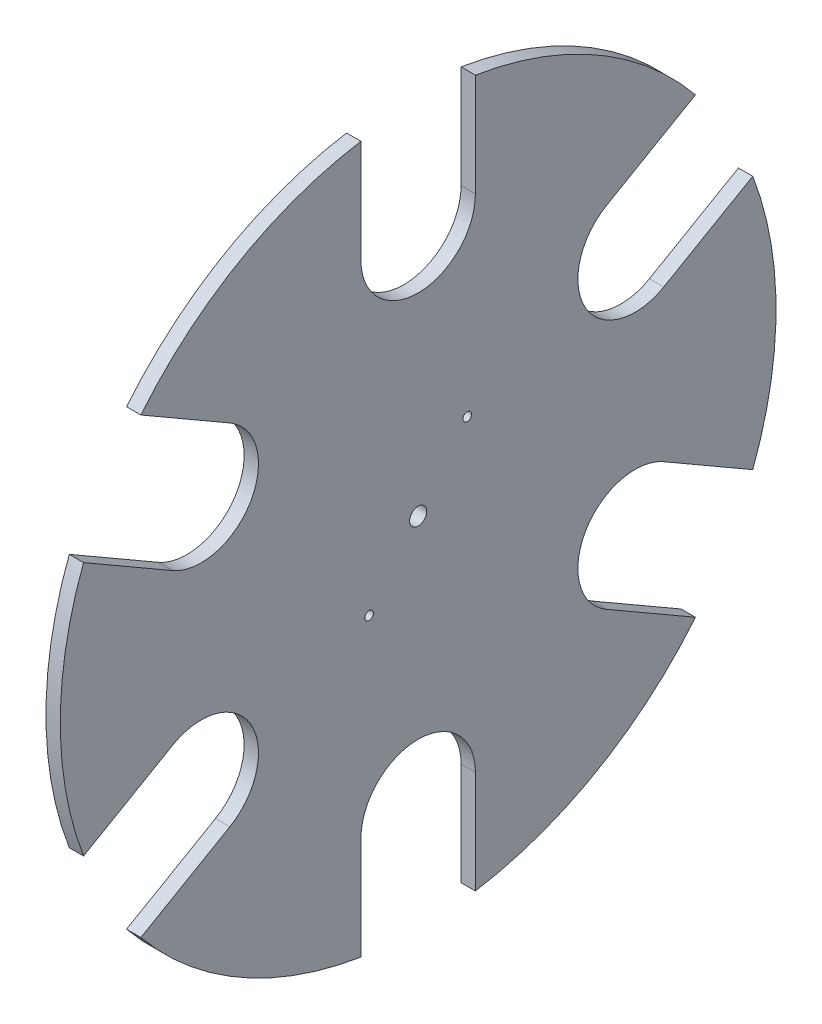
from build123d import *

# Parameters (mm, degrees)
SKETCH1_R               = 250
SKETCH1_R_2             = 6
SKETCH1_R_3             = 40
BOSS_EXTRUDE1_DEPTH     = 10
CUT_EXTRUDE1_DEPTH      = 354.694783677
CUT_EXTRUDE1_DEPTH_BACK = 354.694783677
SKETCH2_R               = 3


with BuildPart() as part:
    # Sketch1 → Boss-Extrude1 (new body)
    with BuildSketch(Plane(origin=(0, 0, 0), x_dir=(0, 0, -1), z_dir=(1, 0, 0))):
        Circle(SKETCH1_R)
        Circle(SKETCH1_R_2, mode=Mode.SUBTRACT)
        with Locations((0, 175)):
            Circle(SKETCH1_R_3, mode=Mode.SUBTRACT)
        with Locations((151.554445662, 87.5)):
            Circle(SKETCH1_R_3, mode=Mode.SUBTRACT)
        with Locations((151.554445662, -87.5)):
            Circle(SKETCH1_R_3, mode=Mode.SUBTRACT)
        with Locations((0, -175)):
            Circle(SKETCH1_R_3, mode=Mode.SUBTRACT)
        with Locations((-151.554445662, -87.5)):
            Circle(SKETCH1_R_3, mode=Mode.SUBTRACT)
        with Locations((-151.554445662, 87.5)):
            Circle(SKETCH1_R_3, mode=Mode.SUBTRACT)
    extrude(amount=BOSS_EXTRUDE1_DEPTH)

    # Sketch2 → Cut-Extrude1 (cut, two sides: drawn at the far end of the back side and taken through both)
    with BuildSketch(Plane.ZY.offset(-CUT_EXTRUDE1_DEPTH_BACK)):
        with Locations((-34.248701956, 43.035176476)):
            Circle(SKETCH2_R)
        with Locations((34.248701956, -43.035176476)):
            Circle(SKETCH2_R)
        with BuildLine():
            Line((-40, 175), (-40, 246.779253585))
            ThreePointArc((-40, 246.779253585), (0, 250), (40, 246.779253585))
            Line((40, 246.779253585), (40, 175))
            ThreePointArc((40, 175), (0, 215), (-40, 175))
        make_face()
        with BuildLine():
            Line((131.554445662, 122.141016151), (193.717102732, 158.030642944))
            ThreePointArc((193.717102732, 158.030642944), (216.506350946, 125), (233.717102732, 88.748610641))
            Line((233.717102732, 88.748610641), (171.554445662, 52.858983849))
            ThreePointArc((171.554445662, 52.858983849), (186.195461814, 107.5), (131.554445662, 122.141016151))
        make_face()
        with BuildLine():
            Line((171.554445662, -52.858983849), (233.717102732, -88.748610641))
            ThreePointArc((233.717102732, -88.748610641), (216.506350946, -125), (193.717102732, -158.030642944))
            Line((193.717102732, -158.030642944), (131.554445662, -122.141016151))
            ThreePointArc((131.554445662, -122.141016151), (186.195461814, -107.5), (171.554445662, -52.858983849))
        make_face()
        with BuildLine():
            Line((40, -175), (40, -246.779253585))
            ThreePointArc((40, -246.779253585), (0, -250), (-40, -246.779253585))
            Line((-40, -246.779253585), (-40, -175))
            ThreePointArc((-40, -175), (0, -215), (40, -175))
        make_face()
        with BuildLine():
            Line((-131.554445662, -122.141016151), (-193.717102732, -158.030642944))
            ThreePointArc((-193.717102732, -158.030642944), (-216.506350946, -125), (-233.717102732, -88.748610641))
            Line((-233.717102732, -88.748610641), (-171.554445662, -52.858983849))
            ThreePointArc((-171.554445662, -52.858983849), (-186.195461814, -107.5), (-131.554445662, -122.141016151))
        make_face()
        with BuildLine():
            Line((-171.554445662, 52.858983849), (-233.717102732, 88.748610641))
            ThreePointArc((-233.717102732, 88.748610641), (-216.506350946, 125), (-193.717102732, 158.030642944))
            Line((-193.717102732, 158.030642944), (-131.554445662, 122.141016151))
            ThreePointArc((-131.554445662, 122.141016151), (-186.195461814, 107.5), (-171.554445662, 52.858983849))
        make_face()
    extrude(amount=CUT_EXTRUDE1_DEPTH + CUT_EXTRUDE1_DEPTH_BACK, mode=Mode.SUBTRACT)


solid = part.part
